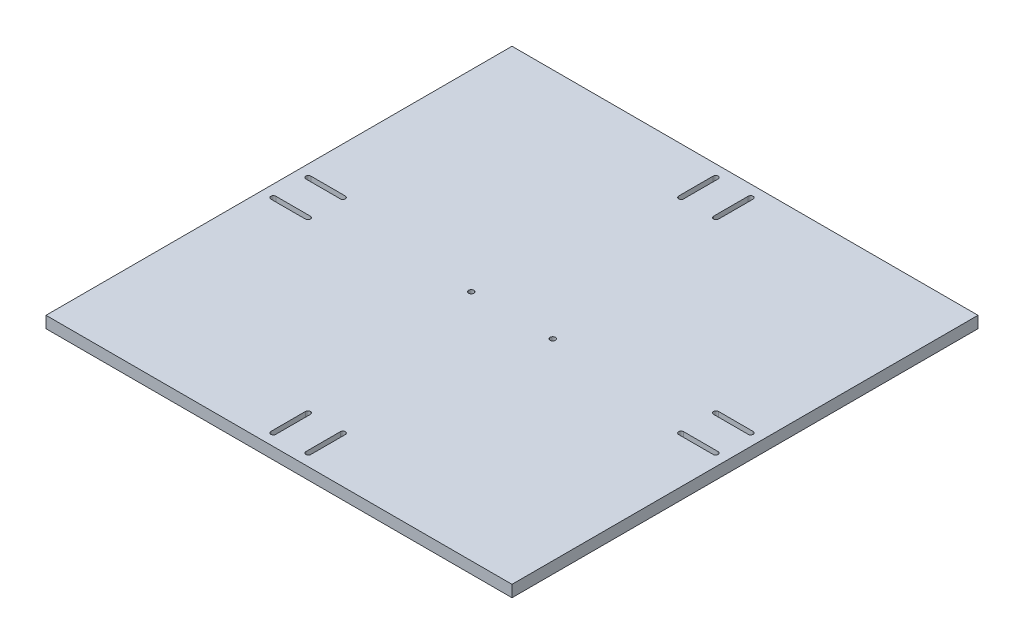
from build123d import *

# Parameters (mm, degrees)
ESBO_O1_W                  = 400
ESBO_O1_H                  = 400
RESSALTO_EXTRUS_O1_DEPTH   = 10
CORTE_EXTRUS_O2_DEPTH      = 566.773806393
CORTE_EXTRUS_O2_DEPTH_BACK = 566.773806393
ESBO_O3_R                  = 2.25
CORTE_EXTRUS_O3_DEPTH      = 566.773806393


with BuildPart() as part:
    # Esboço1 → Ressalto-extrusão1 (new body)
    with BuildSketch(Plane(origin=(0, 0, 0), x_dir=(1, 0, 0), z_dir=(0, 1, 0))):
        with Locations((200, 200)):
            Rectangle(ESBO_O1_W, ESBO_O1_H)
    extrude(amount=RESSALTO_EXTRUS_O1_DEPTH)

    # Esboço2 → Corte-extrusão2 (cut, two sides: drawn at the far end of the back side and taken through both)
    with BuildSketch(Plane(origin=(0, 10, 0), x_dir=(1, 0, 0), z_dir=(0, 1, 0)).offset(-CORTE_EXTRUS_O2_DEPTH_BACK)):
        with BuildLine():
            Line((182.85, 389.85), (182.85, 360.15))
            ThreePointArc((182.85, 360.15), (185, 358), (187.15, 360.15))
            Line((187.15, 360.15), (187.15, 389.85))
            ThreePointArc((187.15, 389.85), (185, 392), (182.85, 389.85))
        make_face()
        with BuildLine():
            Line((212.85, 389.85), (212.85, 360.15))
            ThreePointArc((212.85, 360.15), (215, 358), (217.15, 360.15))
            Line((217.15, 360.15), (217.15, 389.85))
            ThreePointArc((217.15, 389.85), (215, 392), (212.85, 389.85))
        make_face()
        with BuildLine():
            Line((389.85, 182.85), (360.15, 182.85))
            ThreePointArc((360.15, 182.85), (358, 185), (360.15, 187.15))
            Line((360.15, 187.15), (389.85, 187.15))
            ThreePointArc((389.85, 187.15), (392, 185), (389.85, 182.85))
        make_face()
        with BuildLine():
            Line((389.85, 212.85), (360.15, 212.85))
            ThreePointArc((360.15, 212.85), (358, 215), (360.15, 217.15))
            Line((360.15, 217.15), (389.85, 217.15))
            ThreePointArc((389.85, 217.15), (392, 215), (389.85, 212.85))
        make_face()
        with BuildLine():
            Line((182.85, 10.15), (182.85, 39.85))
            ThreePointArc((182.85, 39.85), (185, 42), (187.15, 39.85))
            Line((187.15, 39.85), (187.15, 10.15))
            ThreePointArc((187.15, 10.15), (185, 8), (182.85, 10.15))
        make_face()
        with BuildLine():
            Line((212.85, 10.15), (212.85, 39.85))
            ThreePointArc((212.85, 39.85), (215, 42), (217.15, 39.85))
            Line((217.15, 39.85), (217.15, 10.15))
            ThreePointArc((217.15, 10.15), (215, 8), (212.85, 10.15))
        make_face()
        with BuildLine():
            Line((10.15, 217.15), (39.85, 217.15))
            ThreePointArc((39.85, 217.15), (42, 215), (39.85, 212.85))
            Line((39.85, 212.85), (10.15, 212.85))
            ThreePointArc((10.15, 212.85), (8, 215), (10.15, 217.15))
        make_face()
        with BuildLine():
            Line((10.15, 187.15), (39.85, 187.15))
            ThreePointArc((39.85, 187.15), (42, 185), (39.85, 182.85))
            Line((39.85, 182.85), (10.15, 182.85))
            ThreePointArc((10.15, 182.85), (8, 185), (10.15, 187.15))
        make_face()
    extrude(amount=CORTE_EXTRUS_O2_DEPTH + CORTE_EXTRUS_O2_DEPTH_BACK, mode=Mode.SUBTRACT)

    # Esboço3 → Corte-extrusão3 (cut, through all)
    with BuildSketch(Plane(origin=(0, 10, 0), x_dir=(1, 0, 0), z_dir=(0, 1, 0))):
        with Locations((165, 200)):
            Circle(ESBO_O3_R)
        with Locations((235, 200)):
            Circle(ESBO_O3_R)
    extrude(amount=-CORTE_EXTRUS_O3_DEPTH, mode=Mode.SUBTRACT)


solid = part.part
